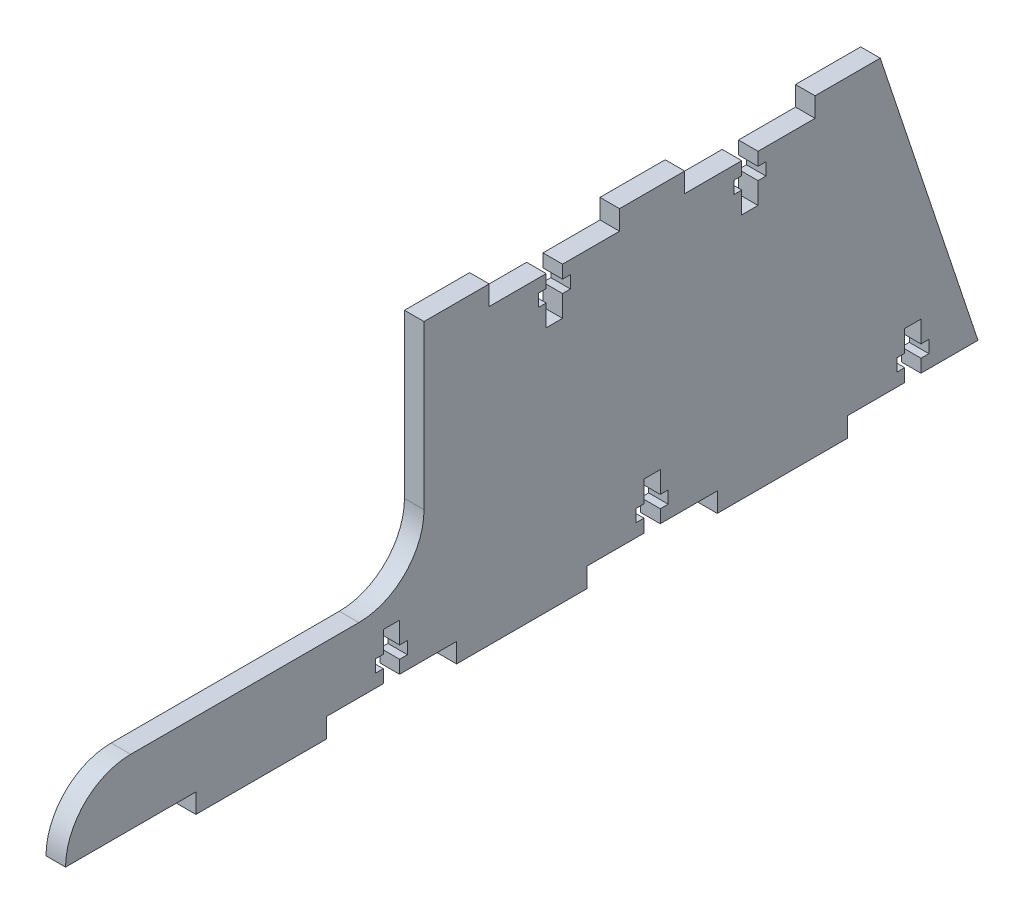
from build123d import *

# Parameters (mm, degrees)
BOSS_EXTRUDE1_DEPTH     = 3.81
CUT_EXTRUDE1_DEPTH      = 108.860315687
CUT_EXTRUDE1_DEPTH_BACK = 108.860315687
FILLET3_START           = -1
FILLET3_DEPTH           = 6
FILLET3_2_DEPTH         = 3.81


with BuildPart() as part:
    # Sketch1 → Boss-Extrude1 (new body)
    with BuildSketch(Plane(origin=(0, 0, 0), x_dir=(0, 0, -1), z_dir=(1, 0, 0))):
        Polygon((-88.9, 3.81), (-63.5, 3.81), (-63.5, 0), (-38.1, 0), (-38.1, 3.81), (-26.9875, 3.81), (-26.9875, 6.35), (-28.5242, 6.35), (-28.5242, 8.763), (-26.9875, 8.763), (-26.9875, 12.954), (-23.8125, 12.954), (-23.8125, 8.763), (-22.2758, 8.763), (-22.2758, 6.35), (-23.8125, 6.35), (-23.8125, 3.81), (-12.7, 3.81), (-12.7, 0), (12.7, 0), (12.7, 3.81), (23.8125, 3.81), (23.8125, 6.35), (22.2758, 6.35), (22.2758, 8.763), (23.8125, 8.763), (23.8125, 12.954), (26.9875, 12.954), (26.9875, 8.763), (28.5242, 8.763), (28.5242, 6.35), (26.9875, 6.35), (26.9875, 3.81), (38.1, 3.81), (38.1, 0), (63.5, 0), (63.5, 3.81), (74.6125, 3.81), (74.6125, 6.35), (73.0758, 6.35), (73.0758, 8.763), (74.6125, 8.763), (74.6125, 12.954), (77.7875, 12.954), (77.7875, 8.763), (79.3242, 8.763), (79.3242, 6.35), (77.7875, 6.35), (77.7875, 3.81), (88.9, 3.81), (69.85, 60.96), (57.15, 60.96), (57.15, 57.15), (46.0375, 57.15), (46.0375, 54.61), (47.5742, 54.61), (47.5742, 52.197), (46.0375, 52.197), (46.0375, 48.006), (42.8625, 48.006), (42.8625, 52.197), (41.3258, 52.197), (41.3258, 54.61), (42.8625, 54.61), (42.8625, 57.15), (31.75, 57.15), (31.75, 60.96), (19.05, 60.96), (19.05, 57.15), (7.9375, 57.15), (7.9375, 54.61), (9.4742, 54.61), (9.4742, 52.197), (7.9375, 52.197), (7.9375, 48.006), (4.7625, 48.006), (4.7625, 52.197), (3.2258, 52.197), (3.2258, 54.61), (4.7625, 54.61), (4.7625, 57.15), (-6.35, 57.15), (-6.35, 60.96), (-19.05, 60.96), (-88.9, 16.51), align=None)
    extrude(amount=BOSS_EXTRUDE1_DEPTH)

    # Sketch2 → Cut-Extrude1 (cut, two sides: drawn at the far end of the back side and taken through both)
    with BuildSketch(Plane(origin=(0, 0, 0), x_dir=(0, 0, -1), z_dir=(1, 0, 0)).offset(-CUT_EXTRUDE1_DEPTH_BACK)):
        Polygon((-37.957173184, 48.928162519), (-88.9, 16.51), (-19.05, 16.51), (-19.05, 60.96), align=None)
    extrude(amount=CUT_EXTRUDE1_DEPTH + CUT_EXTRUDE1_DEPTH_BACK, mode=Mode.SUBTRACT)

    # Fillet3: read off the stored shape, not the designer's step
    # Fillet3 outline → Fillet3 (cut)
    with BuildSketch(Plane.YZ.offset(FILLET3_START)):
        with BuildLine():
            ThreePointArc((3.81, 88.9), (12.790256121, 85.180256121), (16.51, 76.2))
            Line((16.51, 76.2), (16.51, 88.9))
            Line((16.51, 88.9), (3.81, 88.9))
        make_face()
    extrude(amount=FILLET3_DEPTH, mode=Mode.SUBTRACT)

    # Fillet3 2 outline → Fillet3 2 (add)
    with BuildSketch(Plane.YZ):
        with BuildLine():
            ThreePointArc((29.21, 19.05), (20.229743879, 22.769743879), (16.51, 31.75))
            Line((16.51, 31.75), (16.51, 19.05))
            Line((16.51, 19.05), (29.21, 19.05))
        make_face()
    extrude(amount=FILLET3_2_DEPTH)


solid = part.part
